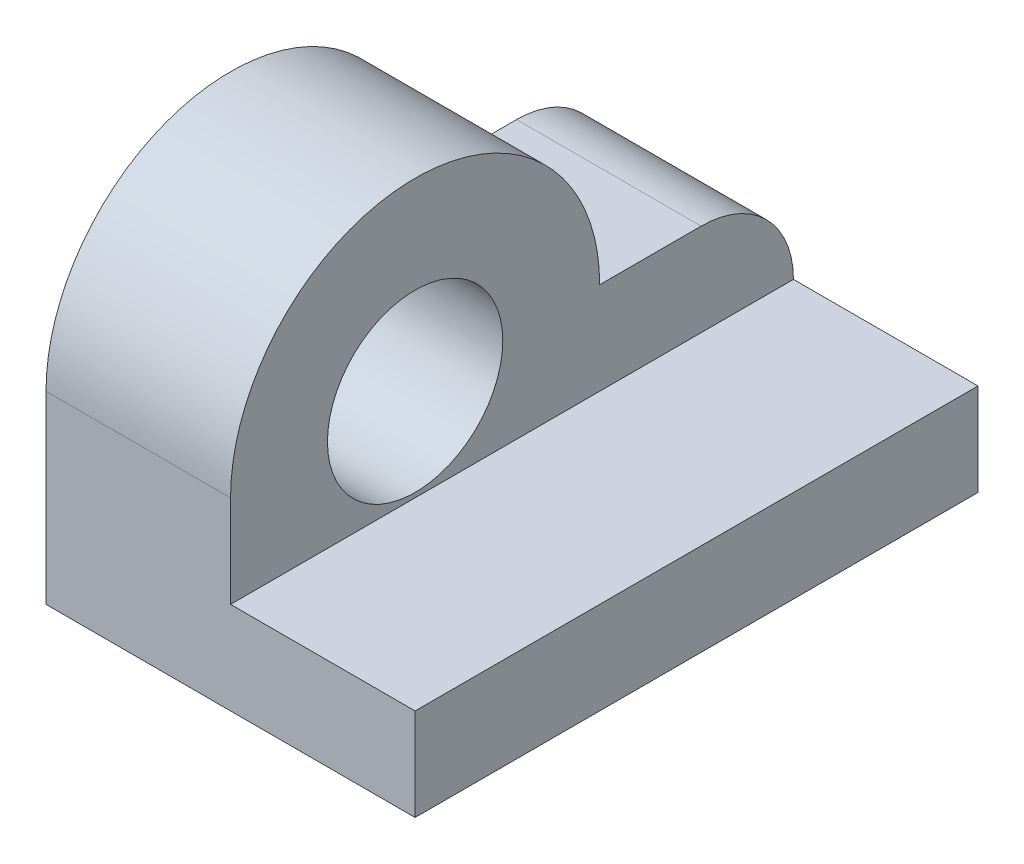
from build123d import *

# Parameters (mm, degrees)
SKETCH1_W           = 40
SKETCH1_H           = 61
BOSS_EXTRUDE1_DEPTH = 40
SKETCH2_W           = 20
SKETCH2_H           = 61
CUT_EXTRUDE1_DEPTH  = 30
SKETCH3_R           = 9.5
CUT_EXTRUDE3_DEPTH  = 55.13178364


with BuildPart() as part:
    # Sketch1 → Boss-Extrude1 (new body)
    with BuildSketch(Plane(origin=(0, 0, 0), x_dir=(1, 0, 0), z_dir=(0, 1, 0))):
        Rectangle(SKETCH1_W, SKETCH1_H)
    extrude(amount=BOSS_EXTRUDE1_DEPTH)

    # Sketch2 → Cut-Extrude1 (cut)
    with BuildSketch(Plane(origin=(0, 40, 0), x_dir=(1, 0, 0), z_dir=(0, 1, 0))):
        with Locations((10, 0)):
            Rectangle(SKETCH2_W, SKETCH2_H)
    extrude(amount=-CUT_EXTRUDE1_DEPTH, mode=Mode.SUBTRACT)

    # Sketch3 → Cut-Extrude3 (cut, through all)
    with BuildSketch(Plane(origin=(0, 0, 0), x_dir=(0, 0, -1), z_dir=(1, 0, 0))):
        with Locations((-10.5, 20)):
            Circle(SKETCH3_R)
        with BuildLine():
            Line((30.5, 40), (-10.5, 40))
            ThreePointArc((-10.5, 40), (3.642135624, 34.142135624), (9.5, 20))
            Line((9.5, 20), (20.499888339, 20))
            ThreePointArc((20.499888339, 20), (27.554228667, 17.087755818), (30.49977668, 10.047256507))
            Line((30.49977668, 10.047256507), (30.5, 10))
            Line((30.5, 10), (30.5, 40))
        make_face()
        with BuildLine():
            Line((-30.5, 40), (-30.5, 20))
            ThreePointArc((-30.5, 20), (-24.642135624, 34.142135624), (-10.5, 40))
            Line((-10.5, 40), (-30.5, 40))
        make_face()
    extrude(amount=-CUT_EXTRUDE3_DEPTH, mode=Mode.SUBTRACT)


solid = part.part
